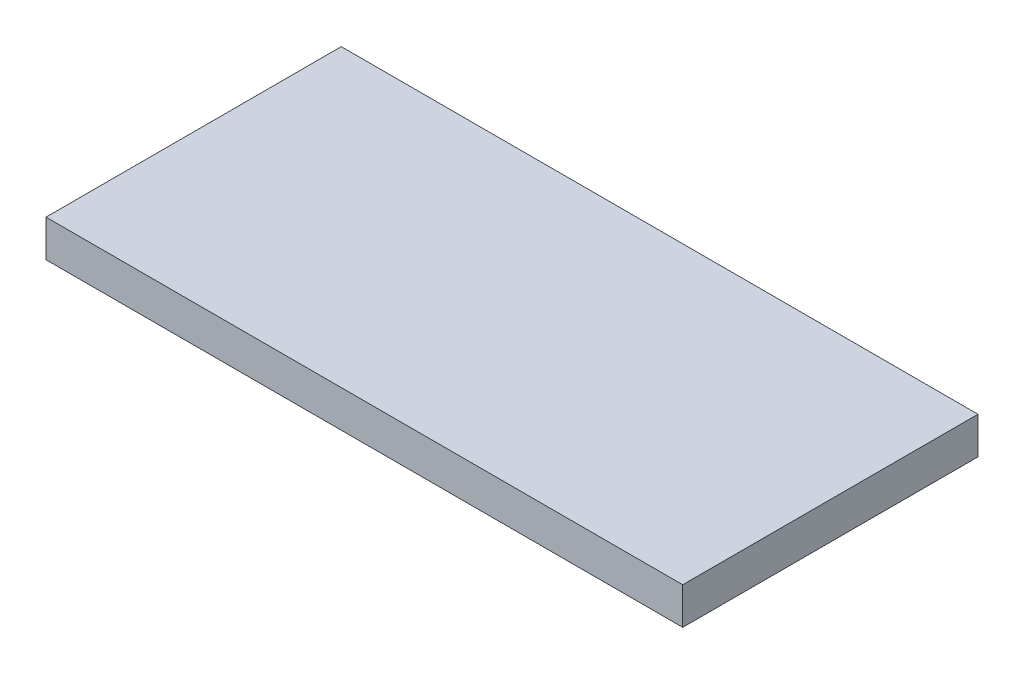
from build123d import *

# Parameters (mm, degrees)
SKETCH1_W           = 876.3
SKETCH1_H           = 50.8
BOSS_EXTRUDE1_DEPTH = 203.2


with BuildPart() as part:
    # Sketch1 → Boss-Extrude1 (new, symmetric)
    with BuildSketch(Plane.XY):
        Rectangle(SKETCH1_W, SKETCH1_H)
    extrude(amount=BOSS_EXTRUDE1_DEPTH, both=True)


solid = part.part
